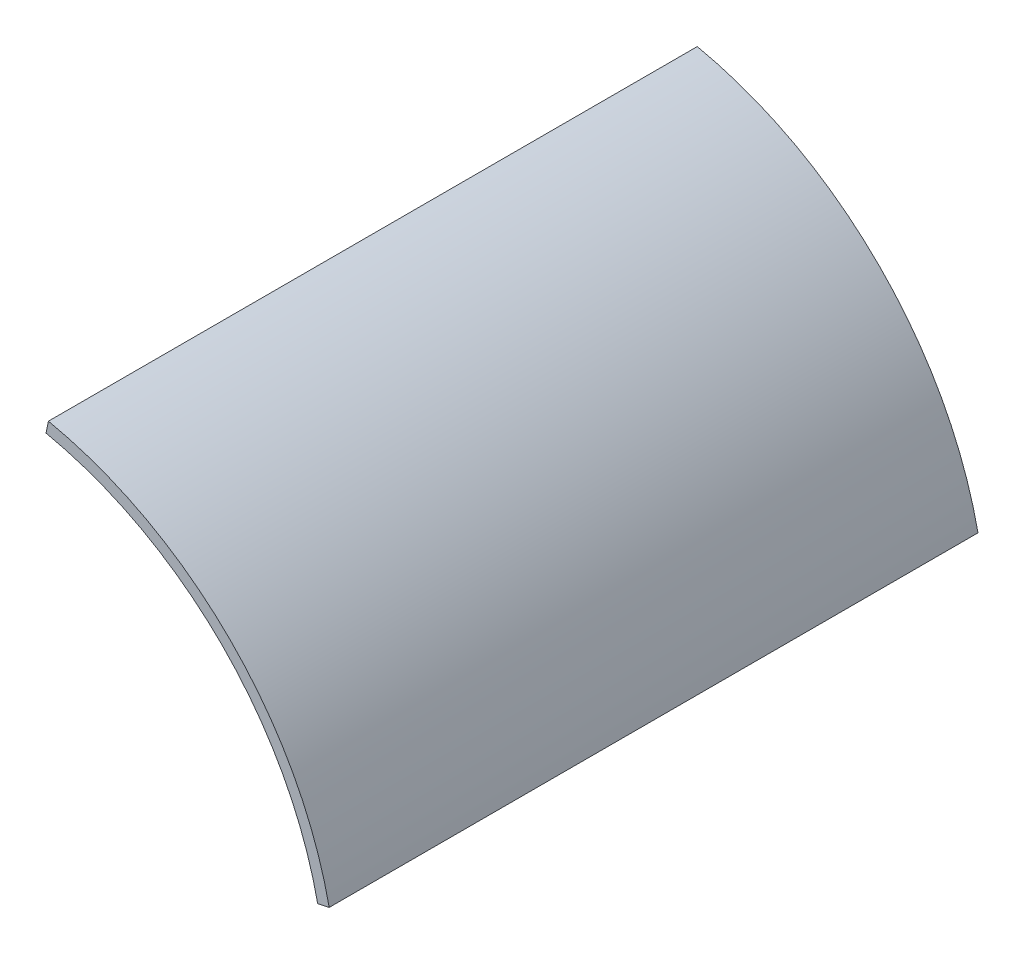
from build123d import *

# Parameters (mm, degrees)
SALIENTE_EXTRUIR1_DEPTH = 55


with BuildPart() as part:
    # Croquis1 → Saliente-Extruir1 (new body)
    with BuildSketch(Plane.XY):
        with BuildLine():
            Line((6.424471246, 30.224760863), (6.216559555, 29.246613262))
            ThreePointArc((6.216559555, 29.246613262), (21.142492757, 21.142492757), (29.246613262, 6.216559555))
            Line((29.246613262, 6.216559555), (30.224760863, 6.424471246))
            ThreePointArc((30.224760863, 6.424471246), (21.849599539, 21.849599539), (6.424471246, 30.224760863))
        make_face()
    extrude(amount=SALIENTE_EXTRUIR1_DEPTH)


solid = part.part
